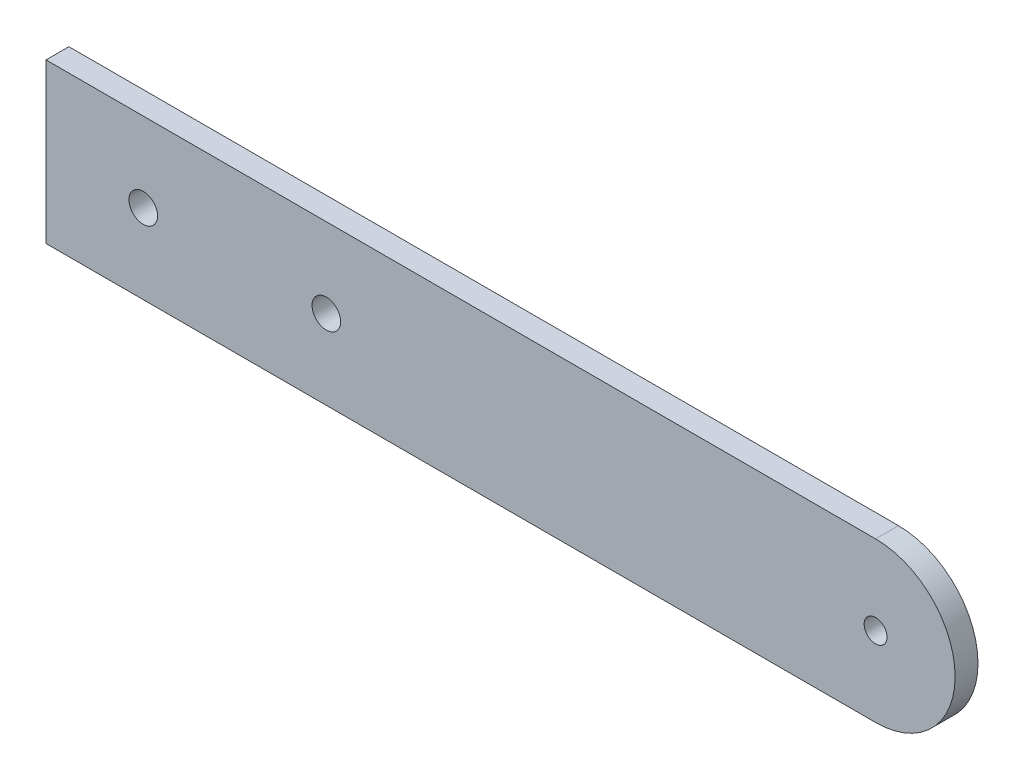
from build123d import *

# Parameters (mm, degrees)
SKETCH_1_R      = 2.5
SKETCH_1_R_2    = 2
EXTRUDE_1_DEPTH = 4


with BuildPart() as part:
    # 草图1 → 凸台-拉伸1 (new body)
    with BuildSketch(Plane.XY):
        with BuildLine():
            Line((-75.538677918, 13.9), (52.461322082, 13.9))
            ThreePointArc((52.461322082, 13.9), (66.361322082, 0), (52.461322082, -13.9))
            Line((52.461322082, -13.9), (-75.538677918, -13.9))
            Line((-75.538677918, -13.9), (-92.538677918, -13.9))
            Line((-92.538677918, -13.9), (-92.538677918, 13.9))
            Line((-92.538677918, 13.9), (-75.538677918, 13.9))
        make_face()
        with Locations((-75.538677918, 0)):
            Circle(SKETCH_1_R, mode=Mode.SUBTRACT)
        with Locations((52.461322082, 0)):
            Circle(SKETCH_1_R_2, mode=Mode.SUBTRACT)
        with Locations((-43.538677918, 0)):
            Circle(SKETCH_1_R, mode=Mode.SUBTRACT)
    extrude(amount=EXTRUDE_1_DEPTH)


solid = part.part
